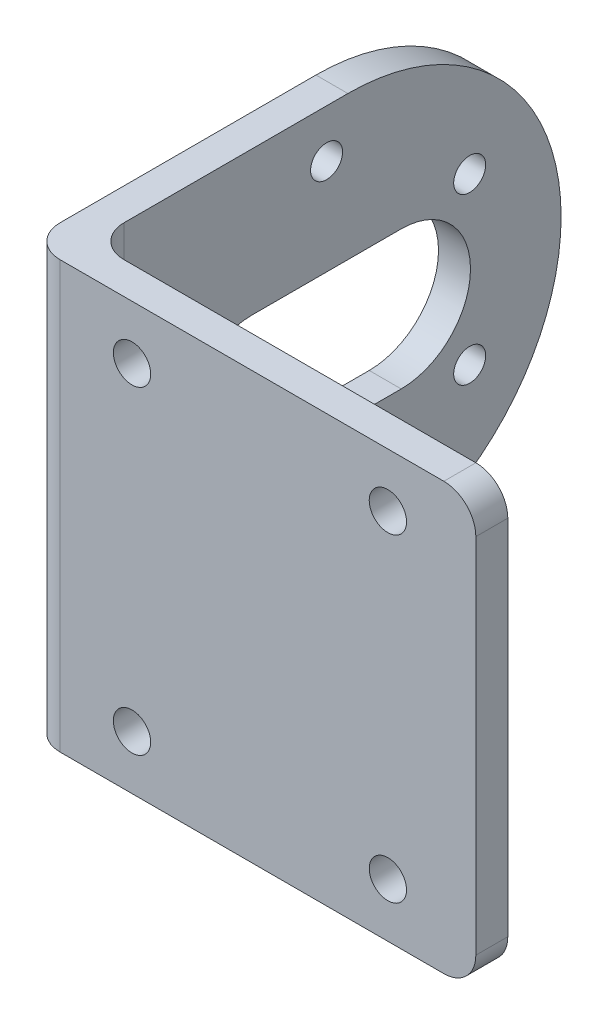
from build123d import *

# Parameters (mm, degrees)
ESTRUSIONE_ESTRUSIONE1_DEPTH = 40
SCHIZZO2_R                   = 1.5
TAGLIO_ESTRUSIONE1_DEPTH     = 74.006848994
RACCORDO1_R                  = 3
RACCORDO2_R                  = 20
SCHIZZO3_R                   = 1.75
TAGLIO_ESTRUSIONE2_DEPTH     = 73.801098893
RACCORDO3_R                  = 3


with BuildPart() as part:
    # Schizzo1 → Estrusione-Estrusione1 (new body)
    with BuildSketch(Plane(origin=(0, 0, 0), x_dir=(1, 0, 0), z_dir=(0, 1, 0))):
        Polygon((0, 0), (0, 47), (3, 47), (3, 3), (42, 3), (42, 0), align=None)
    extrude(amount=ESTRUSIONE_ESTRUSIONE1_DEPTH)

    # Schizzo2 → Taglio-Estrusione1 (cut, through all)
    with BuildSketch(Plane(origin=(3, 0, 0), x_dir=(0, 0, -1), z_dir=(1, 0, 0))):
        with Locations((25, 4.5)):
            Circle(SCHIZZO2_R)
        with Locations((11.576606241, 12.25)):
            Circle(SCHIZZO2_R)
        with Locations((11.576606241, 27.75)):
            Circle(SCHIZZO2_R)
        with Locations((25, 35.5)):
            Circle(SCHIZZO2_R)
        with Locations((38.423393759, 27.75)):
            Circle(SCHIZZO2_R)
        with Locations((38.423393759, 12.25)):
            Circle(SCHIZZO2_R)
        with BuildLine():
            Line((18, 26.5), (32, 26.5))
            ThreePointArc((32, 26.5), (38.5, 20), (32, 13.5))
            Line((32, 13.5), (18, 13.5))
            ThreePointArc((18, 13.5), (11.5, 20), (18, 26.5))
        make_face()
    extrude(amount=-TAGLIO_ESTRUSIONE1_DEPTH, mode=Mode.SUBTRACT)

    # Raccordo1
    raccordo1_edges = [part.edges().sort_by_distance(p)[0] for p in [
        (0, 20, 0),
        (3, 20, -3),
    ]]
    fillet(raccordo1_edges, radius=RACCORDO1_R)

    # Raccordo2
    raccordo2_edges = [part.edges().sort_by_distance(p)[0] for p in [
        (1.5, 0, -47),
        (1.5, 40, -47),
    ]]
    fillet(raccordo2_edges, radius=RACCORDO2_R - 0.0001)  # a hair under: the kernel refuses the full size

    # Schizzo3 → Taglio-Estrusione2 (cut, through all)
    with BuildSketch(Plane(origin=(0, 0, -3), x_dir=(-1, 0, 0), z_dir=(0, 0, -1))):
        with Locations((-33.75, 34.95)):
            Circle(SCHIZZO3_R)
        with Locations((-9.75, 34.95)):
            Circle(SCHIZZO3_R)
        with Locations(Location((-9.75, 5.05, 0), (0, 0, 180))):
            Circle(SCHIZZO3_R)
        with Locations(Location((-33.75, 5.05, 0), (0, 0, 180))):
            Circle(SCHIZZO3_R)
    extrude(amount=-TAGLIO_ESTRUSIONE2_DEPTH, mode=Mode.SUBTRACT)

    # Raccordo3
    raccordo3_edges = [part.edges().sort_by_distance(p)[0] for p in [
        (42, 0, -1.5),
        (42, 40, -1.5),
    ]]
    fillet(raccordo3_edges, radius=RACCORDO3_R)


solid = part.part
